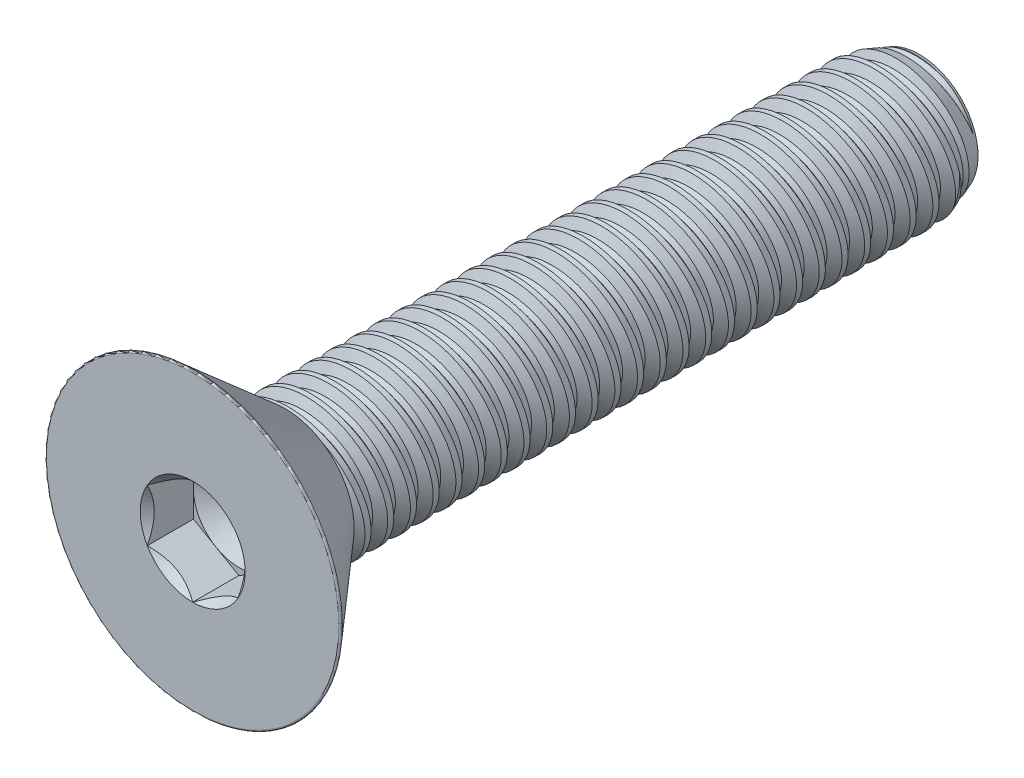
from build123d import *

# Parameters (mm, degrees)
SKETCH1_W          = 22.1742
SKETCH1_H          = 2.413
LPATTERN1_COUNT    = 28
LPATTERN1_PITCH    = 0.79375
LPATTERN2_COUNT    = 2
LPATTERN2_PITCH    = 0.79375
SKETCH4_R          = 5.2197
EXTRUDE1_DEPTH     = 3.2258
FILLET1_R          = 0.0508
CUT_EXTRUDE1_DEPTH = 1.6129
SKETCH7_R          = 1.833087105
CUT_EXTRUDE4_DEPTH = 1.6129
CUT_EXTRUDE4_DRAFT = -45
SKETCH8_R          = 1.5875
CUT_EXTRUDE5_DEPTH = 0.537633333
CUT_EXTRUDE5_DRAFT = -60


with BuildPart() as part:
    # Sketch1 → Revolve1 (revolve)
    with BuildSketch(Plane(origin=(0, 0, 0), x_dir=(0, 0, -1), z_dir=(1, 0, 0)), mode=Mode.PRIVATE) as revolve1_sk:
        with Locations((11.0871, 1.2065)):
            Rectangle(SKETCH1_W, SKETCH1_H)
    revolve(revolve1_sk.sketch.rotate(Axis((0, 0, 0), (0, 0, 1)), 143.520691449), axis=Axis((0, 0, 0), (0, 0, 1)))

    # Sketch2 → Cut-Revolve1 (revolve, cut)
    with BuildSketch(Plane(origin=(0, 0, 0), x_dir=(0, 0, -1), z_dir=(1, 0, 0)), mode=Mode.PRIVATE) as cut_revolve1_sk:
        Polygon((0.097903365, 2.429102527), (0.783226924, 2.541820218), (0.608194498, 2.077629892), (0.412387767, 2.045424837), align=None)
    cut_revolve1 = revolve(cut_revolve1_sk.sketch.rotate(Axis((0, -0.139697061, 0), (0, 0.16229318767089765, -0.9867425810390564)), 180), axis=Axis((0, -0.139697061, 0), (0, 0.16229318767089765, -0.9867425810390564)), mode=Mode.SUBTRACT)

    # Sketch3 → Cut-Revolve2 (revolve, cut)
    with BuildSketch(Plane(origin=(0, 0, 0), x_dir=(0, 0, -1), z_dir=(1, 0, 0)), mode=Mode.PRIVATE) as cut_revolve2_sk:
        Polygon((22.1742, 2.045424837), (21.16429554, 2.413), (22.1742, 2.413), align=None)
    revolve(cut_revolve2_sk.sketch.rotate(Axis((0, 0, -21.16429554), (0, 0, 1)), 143.520691449), axis=Axis((0, 0, -21.16429554), (0, 0, 1)), mode=Mode.SUBTRACT)

    # LPattern1: Cut-Revolve1 ×28
    with Locations(*[(0, 0, -i * LPATTERN1_PITCH) for i in range(1, LPATTERN1_COUNT)]):
        add(cut_revolve1, mode=Mode.SUBTRACT)

    # LPattern2: Cut-Revolve1 ×2
    with Locations(*[(0, 0, i * LPATTERN2_PITCH) for i in range(1, LPATTERN2_COUNT)]):
        add(cut_revolve1, mode=Mode.SUBTRACT)

    # Sketch4 → Extrude1 (add)
    with BuildSketch(Plane.XY):
        Circle(SKETCH4_R)
    extrude(amount=EXTRUDE1_DEPTH)

    # Sketch9 → Cut-Revolve3 (revolve, cut)
    with BuildSketch(Plane(origin=(0, 0, 0), x_dir=(0, 0, -1), z_dir=(1, 0, 0)), mode=Mode.PRIVATE) as cut_revolve3_sk:
        Polygon((-3.2258, 5.2197), (0, 2.415554841), (0, 5.2197), align=None)
    revolve(cut_revolve3_sk.sketch.rotate(Axis((0, 0, 0), (0, 0, 1)), 180), axis=Axis((0, 0, 0), (0, 0, 1)), mode=Mode.SUBTRACT)

    # Fillet1
    fillet1_edges = [part.edges().sort_by_distance(p)[0] for p in [
        (0, 5.2197, 3.2258),
    ]]
    fillet(fillet1_edges, radius=FILLET1_R)

    # Sketch6 → Cut-Extrude1 (cut)
    with BuildSketch(Plane.XY.offset(3.2258)):
        Polygon((0, -1.833087105), (1.5875, -0.916543552), (1.5875, 0.916543552), (0, 1.833087105), (-1.5875, 0.916543552), (-1.5875, -0.916543552), align=None)
    extrude(amount=-CUT_EXTRUDE1_DEPTH, mode=Mode.SUBTRACT)


with BuildPart() as cut_extrude4_tool:
    # Sketch7 → Cut-Extrude4 (with draft: the straight prism first)
    with BuildSketch(Plane.XY.offset(3.2258)):
        Circle(SKETCH7_R)
    extrude(amount=-CUT_EXTRUDE4_DEPTH)
    # Cut-Extrude4: the draft: its side faces are tilted about the plane it starts from
    cut_extrude4_sides = [cut_extrude4_tool.faces().sort_by_distance(p)[0] for p in [
        (-1.833087105, 0, 2.41935),
    ]]
    draft(cut_extrude4_sides, Plane.XY.offset(3.2258), CUT_EXTRUDE4_DRAFT)


with BuildPart() as part_1:
    add(part.part)

    # Cut-Extrude4: cut by cut_extrude4_tool
    add(cut_extrude4_tool.part, mode=Mode.SUBTRACT)


with BuildPart() as cut_extrude5_tool:
    # Sketch8 → Cut-Extrude5 (with draft: the straight prism first)
    with BuildSketch(Plane.XY.offset(1.6129)):
        Circle(SKETCH8_R)
    extrude(amount=-CUT_EXTRUDE5_DEPTH)
    # Cut-Extrude5: the draft: its side faces are tilted about the plane it starts from
    cut_extrude5_sides = [cut_extrude5_tool.faces().sort_by_distance(p)[0] for p in [
        (-1.5875, 0, 1.344083333),
    ]]
    draft(cut_extrude5_sides, Plane.XY.offset(1.6129), CUT_EXTRUDE5_DRAFT)


with BuildPart() as part_2:
    add(part_1.part)

    # Cut-Extrude5: cut by cut_extrude5_tool
    add(cut_extrude5_tool.part, mode=Mode.SUBTRACT)


solid = part_2.part
